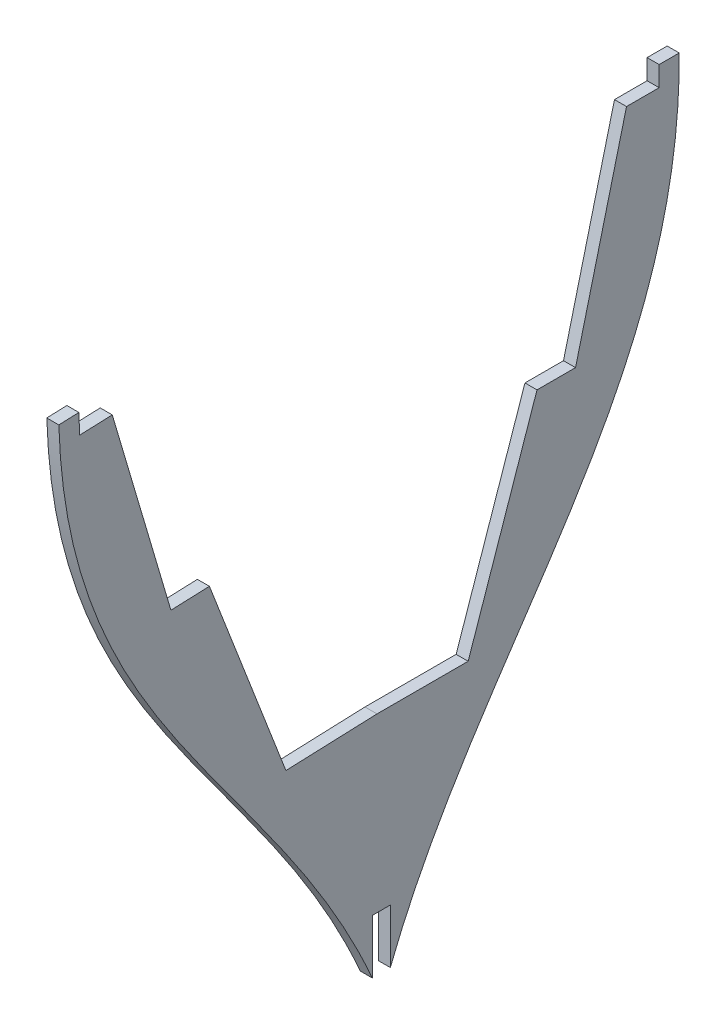
from build123d import *

# Parameters (mm, degrees)
BOSS_EXTRU_3_DEPTH      = 6
ENL_V_MAT_EXTRU_1_DEPTH = 6


with BuildPart() as part:
    # Esquisse2 → Boss.-Extru.3 (new body)
    with BuildSketch(Plane(origin=(0, 0, 0), x_dir=(0, 0, -1), z_dir=(1, 0, 0))):
        with BuildLine():
            Line((148.243380773, 362.223341232), (138.243380773, 362.223341232))
            Line((138.243380773, 362.223341232), (138.243380773, 352.223341232))
            Line((138.243380773, 352.223341232), (121.980460818, 352.223341232))
            Line((121.980460818, 352.223341232), (96.566123307, 252.223341232))
            Line((96.566123307, 252.223341232), (77.362690922, 252.223341232))
            Line((77.362690922, 252.223341232), (43.04756988, 152.223341232))
            Line((43.04756988, 152.223341232), (-2.389560792, 152.223341232))
            Line((-2.389560792, 152.223341232), (-47.793073021, 150.475794075))
            Line((-47.793073021, 150.475794075), (-85.928881948, 249.082019079))
            Line((-85.928881948, 249.082019079), (-105.11810592, 248.343440231))
            Line((-105.11810592, 248.343440231), (-134.359716911, 347.291996247))
            Line((-134.359716911, 347.291996247), (-150.610604107, 346.666511779))
            Line((-150.610604107, 346.666511779), (-150.995211834, 356.659112886))
            Line((-150.995211834, 356.659112886), (-160.987812942, 356.274505159))
            add(Edge.make_bspline(
                [(-160.987812942, 356.274505159), (-156.574103044, 209.766251005), (-47.766358413, 149.781714364), (0.002006152, 27.905391987)],
                knots=[0, 0, 0, 0, 1, 1, 1, 1], degree=3))
            add(Edge.make_bspline(
                [(148.243380773, 362.223341232), (149.467757199, 215.653732265), (43.04756988, 151.528747598), (0.002006152, 27.905391987)],
                knots=[0, 0, 0, 0, 1, 1, 1, 1], degree=3))
        make_face()
    extrude(amount=BOSS_EXTRU_3_DEPTH)

    # Esquisse3 → Enlèv. mat.-Extru.1 (cut)
    with BuildSketch(Plane(origin=(6, 0, 0), x_dir=(0, 0, -1), z_dir=(1, 0, 0))):
        Polygon((-4.754785334, 39.394886532), (-4.754785334, 66.394886532), (4.245214666, 66.394886532), (4.245214666, 39.394886532), (24.57503699, 16.484445816), (-20.535808455, 16.484445816), align=None)
    extrude(amount=-ENL_V_MAT_EXTRU_1_DEPTH, mode=Mode.SUBTRACT)


solid = part.part
